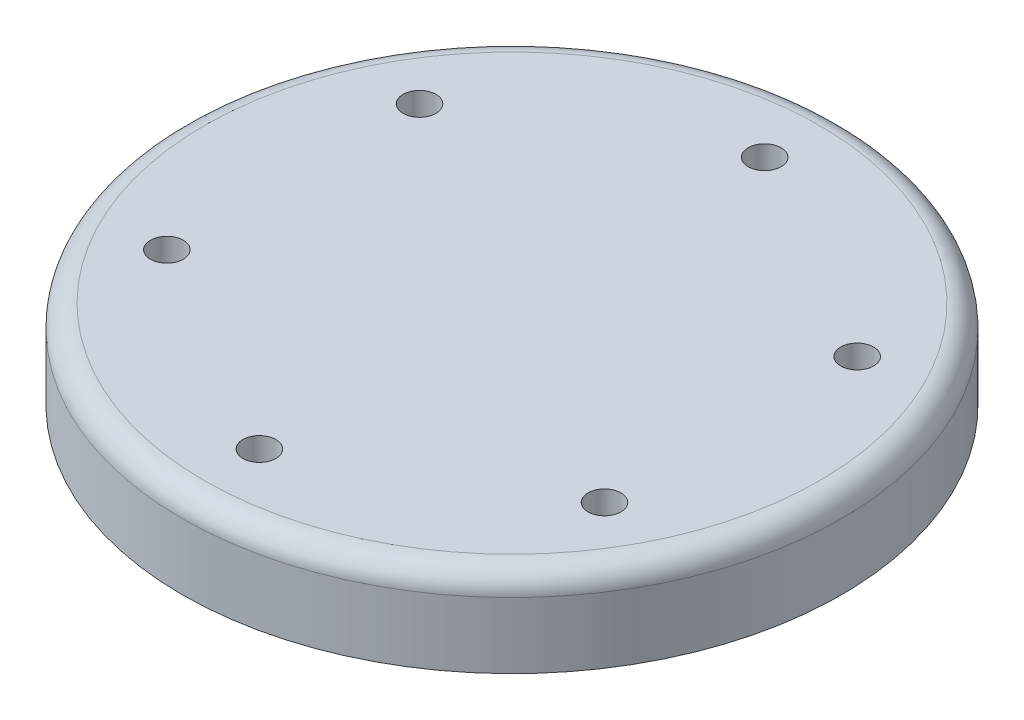
from build123d import *

# Parameters (mm, degrees)
SKETCH1_R           = 30
SKETCH1_R_2         = 1.5
BOSS_EXTRUDE1_DEPTH = 8
FILLET1_R           = 2


with BuildPart() as part:
    # Sketch1 → Boss-Extrude1 (new body)
    with BuildSketch(Plane(origin=(0, 0, 0), x_dir=(1, 0, 0), z_dir=(0, 1, 0))):
        Circle(SKETCH1_R)
        with Locations((0, 23)):
            Circle(SKETCH1_R_2, mode=Mode.SUBTRACT)
        with Locations((19.919084287, 11.500866025)):
            Circle(SKETCH1_R_2, mode=Mode.SUBTRACT)
        with Locations((19.920084287, -11.499133975)):
            Circle(SKETCH1_R_2, mode=Mode.SUBTRACT)
        with Locations((0.002, -23)):
            Circle(SKETCH1_R_2, mode=Mode.SUBTRACT)
        with Locations((-19.917084287, -11.500866025)):
            Circle(SKETCH1_R_2, mode=Mode.SUBTRACT)
        with Locations((-19.918084287, 11.499133975)):
            Circle(SKETCH1_R_2, mode=Mode.SUBTRACT)
    extrude(amount=BOSS_EXTRUDE1_DEPTH)

    # Fillet1
    fillet1_edges = [part.edges().sort_by_distance(p)[0] for p in [
        (-30, 8, 0),
    ]]
    fillet(fillet1_edges, radius=FILLET1_R)


solid = part.part
